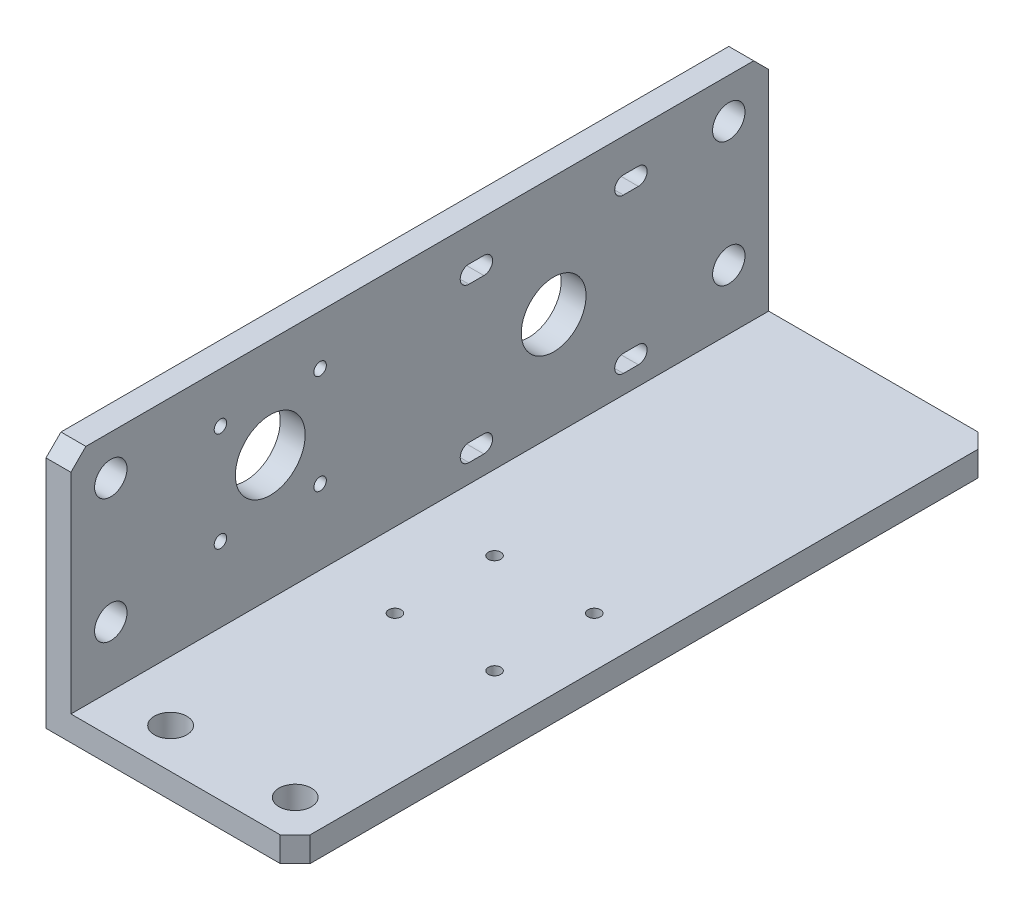
from build123d import *

# Parameters (mm, degrees)
ESTRUSIONE_ESTRUSIONE1_DEPTH = 140
FORO_6_5_6_5_1_D             = 6.5
FORO_6_5_6_5_2_AT_2_COUNT    = 2
FORO_6_5_6_5_2_AT_2_PITCH    = 25
TAGLIO_ESTRUSIONE2_REACH     = 158.844
SCHIZZO9_R                   = 7
TAGLIO_ESTRUSIONE4_REACH     = 158.844
SCHIZZO11_R                  = 6.5
SMUSSO1_SIZE                 = 3
M3_TAPPED_HOLE1_D            = 2.5
M3_TAPPED_HOLE2_D            = 2.5


with BuildPart() as part:
    # Schizzo1 → Estrusione-Estrusione1 (new body)
    with BuildSketch(Plane.XY):
        Polygon((0, 0), (0, 50), (5, 50), (5, 5), (50, 5), (50, 0), align=None)
    extrude(amount=ESTRUSIONE_ESTRUSIONE1_DEPTH)

    # Foro Ø6.5 (6.5)-1 (through all)
    with Locations(Plane(origin=(0, 0, 0), x_dir=(-1, 0, 0), z_dir=(0, -1, 0))):
        with Locations((-17, -132), (-42, -132)):
            Hole(FORO_6_5_6_5_1_D / 2)

    # Schizzo6 → Foro Ø6.5 (6.5)-2 (revolve, cut)
    with BuildSketch(Plane(origin=(0, 42, 132), x_dir=(0, 0, 1), z_dir=(0, 1, 0))):
        Polygon((0, 0), (0, 6.952797012), (3.25, 5), (3.25, 0), align=None)
    foro_6_5_6_5_2 = revolve(axis=Axis((-6.35, 42, 132), (1, 0, 0)), mode=Mode.SUBTRACT)

    # Foro Ø6.5 (6.5)-2 at 2: Foro Ø6.5 (6.5)-2 ×2
    with Locations(*[(0, -i * FORO_6_5_6_5_2_AT_2_PITCH, 0) for i in range(1, FORO_6_5_6_5_2_AT_2_COUNT)]):
        add(foro_6_5_6_5_2, mode=Mode.SUBTRACT)

    # Specchia1: Foro Ø6.5 (6.5)-2 across plane
    add(foro_6_5_6_5_2.mirror(Plane.XY.offset(70)), mode=Mode.SUBTRACT)

    # Specchia1 copy 1 sketch → Specchia1 copy 1 (revolve, cut)
    with BuildSketch(Plane(origin=(0, 17, 8), x_dir=(0, 0, -1), z_dir=(0, 1, 0))):
        Polygon((0, 0), (0, -6.952797012), (3.25, -5), (3.25, 0), align=None)
    revolve(axis=Axis((-6.35, 17, 8), (-1, 0, 0)), mode=Mode.SUBTRACT)

    # Schizzo9 → Taglio-Estrusione2 (cut, up to next)
    with BuildSketch(Plane.ZY, mode=Mode.PRIVATE) as taglio_estrusione2_sk1:
        with Locations((100, 30)):
            Circle(SCHIZZO9_R)
    taglio_estrusione2_tool1 = extrude(taglio_estrusione2_sk1.sketch, amount=-TAGLIO_ESTRUSIONE2_REACH, mode=Mode.PRIVATE) & part.part
    add(taglio_estrusione2_tool1.solids().sort_by_distance((0, 30, 100))[0], mode=Mode.SUBTRACT)

    # Schizzo11 → Taglio-Estrusione4 (cut, up to next)
    with BuildSketch(Plane.ZY, mode=Mode.PRIVATE) as taglio_estrusione4_sk1:
        with Locations((43.140524097, 26)):
            Circle(SCHIZZO11_R)
    taglio_estrusione4_tool1 = extrude(taglio_estrusione4_sk1.sketch, amount=-TAGLIO_ESTRUSIONE4_REACH, mode=Mode.PRIVATE) & part.part
    # Schizzo11 → Taglio-Estrusione4 (cut, up to next)
    with BuildSketch(Plane.ZY, mode=Mode.PRIVATE) as taglio_estrusione4_sk2:
        with BuildLine():
            Line((60.140524097, 39.75), (57.140524097, 39.75))
            ThreePointArc((57.140524097, 39.75), (55.390524097, 41.5), (57.140524097, 43.25))
            Line((57.140524097, 43.25), (60.140524097, 43.25))
            ThreePointArc((60.140524097, 43.25), (61.890524097, 41.5), (60.140524097, 39.75))
        make_face()
    taglio_estrusione4_tool2 = extrude(taglio_estrusione4_sk2.sketch, amount=-TAGLIO_ESTRUSIONE4_REACH, mode=Mode.PRIVATE) & part.part
    # Schizzo11 → Taglio-Estrusione4 (cut, up to next)
    with BuildSketch(Plane.ZY, mode=Mode.PRIVATE) as taglio_estrusione4_sk3:
        with BuildLine():
            Line((60.140524097, 12.25), (57.140524097, 12.25))
            ThreePointArc((57.140524097, 12.25), (55.390524097, 10.5), (57.140524097, 8.75))
            Line((57.140524097, 8.75), (60.140524097, 8.75))
            ThreePointArc((60.140524097, 8.75), (61.890524097, 10.5), (60.140524097, 12.25))
        make_face()
    taglio_estrusione4_tool3 = extrude(taglio_estrusione4_sk3.sketch, amount=-TAGLIO_ESTRUSIONE4_REACH, mode=Mode.PRIVATE) & part.part
    # Schizzo11 → Taglio-Estrusione4 (cut, up to next)
    with BuildSketch(Plane.ZY, mode=Mode.PRIVATE) as taglio_estrusione4_sk4:
        with BuildLine():
            Line((26.140524097, 12.25), (29.140524097, 12.25))
            ThreePointArc((29.140524097, 12.25), (30.890524097, 10.5), (29.140524097, 8.75))
            Line((29.140524097, 8.75), (26.140524097, 8.75))
            ThreePointArc((26.140524097, 8.75), (24.390524097, 10.5), (26.140524097, 12.25))
        make_face()
    taglio_estrusione4_tool4 = extrude(taglio_estrusione4_sk4.sketch, amount=-TAGLIO_ESTRUSIONE4_REACH, mode=Mode.PRIVATE) & part.part
    # Schizzo11 → Taglio-Estrusione4 (cut, up to next)
    with BuildSketch(Plane.ZY, mode=Mode.PRIVATE) as taglio_estrusione4_sk5:
        with BuildLine():
            Line((26.140524097, 39.75), (29.140524097, 39.75))
            ThreePointArc((29.140524097, 39.75), (30.890524097, 41.5), (29.140524097, 43.25))
            Line((29.140524097, 43.25), (26.140524097, 43.25))
            ThreePointArc((26.140524097, 43.25), (24.390524097, 41.5), (26.140524097, 39.75))
        make_face()
    taglio_estrusione4_tool5 = extrude(taglio_estrusione4_sk5.sketch, amount=-TAGLIO_ESTRUSIONE4_REACH, mode=Mode.PRIVATE) & part.part
    add(taglio_estrusione4_tool1.solids().sort_by_distance((0, 26, 43.140524))[0], mode=Mode.SUBTRACT)
    add(taglio_estrusione4_tool2.solids().sort_by_distance((0, 41.5, 58.640524))[0], mode=Mode.SUBTRACT)
    add(taglio_estrusione4_tool3.solids().sort_by_distance((0, 10.5, 58.640524))[0], mode=Mode.SUBTRACT)
    add(taglio_estrusione4_tool4.solids().sort_by_distance((0, 10.5, 27.640524))[0], mode=Mode.SUBTRACT)
    add(taglio_estrusione4_tool5.solids().sort_by_distance((0, 41.5, 27.640524))[0], mode=Mode.SUBTRACT)

    # Smusso1
    smusso1_edges = [part.edges().sort_by_distance(p)[0] for p in [
        (50, 2.5, 0),
        (2.5, 50, 0),
        (2.5, 50, 140),
        (50, 2.5, 140),
    ]]
    chamfer(smusso1_edges, length=SMUSSO1_SIZE)

    # M3 Tapped Hole1 (through all)
    with Locations(Plane(origin=(0, 40, 90), x_dir=(0, 0, -1), z_dir=(-1, 0, 0))):
        with Locations((0, 0), (-20, 0), (-20, 20), (0, 20)):
            Hole(M3_TAPPED_HOLE1_D / 2)

    # M3 Tapped Hole2 (through all)
    with Locations(Plane(origin=(20, 0, 90), x_dir=(-1, 0, 0), z_dir=(0, -1, 0))):
        with Locations((0, 0), (-20, 0), (-20, 20), (0, 20)):
            Hole(M3_TAPPED_HOLE2_D / 2)


solid = part.part
